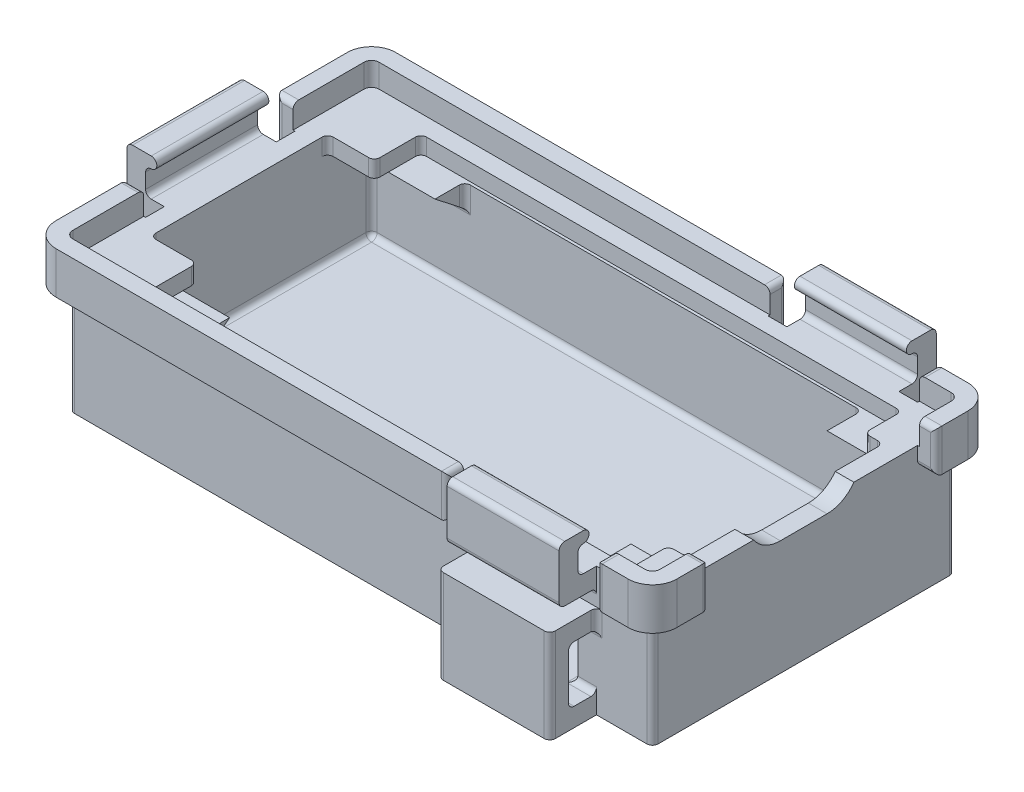
from build123d import *

# Parameters (mm, degrees)
SKETCH_1_W          = 62.5
SKETCH_1_H          = 32.4
SKETCH_1_W_2        = 5
SKETCH_1_H_2        = 0.3
SKETCH_1_W_3        = 6
EXTRUDE_1_DEPTH     = 10
EXTRUDE_2_DEPTH     = 5
EXTRUDE_3_DEPTH     = 6
EXTRUDE_8_DEPTH     = 1.8
FILLET_2_R          = 0.6
SKETCH_3_W          = 62.5
SKETCH_3_H          = 32.4
EXTRUDE_9_DEPTH     = 2
SKETCH_8_W          = 2
SKETCH_8_H          = 4
EXTRUDE_11_DEPTH    = 1.8
SKETCH_5_W          = 8
SKETCH_5_H          = 6
CUT_EXTRUDE_1_DEPTH = 5
SKETCH_6_W          = 12
SKETCH_6_H          = 5
EXTRUDE_10_DEPTH    = 10
SKETCH_9_W          = 3
SKETCH_9_H          = 6
CUT_EXTRUDE_2_DEPTH = 10
FILLET_5_R          = 0.6
FILLET_6_R          = 0.6
SKETCH_10_W         = 4
SKETCH_10_H         = 12
SKETCH_10_W_2       = 12
SKETCH_10_H_2       = 4
EXTRUDE_12_DEPTH    = 2
SKETCH_10_3_W       = 2
SKETCH_10_3_H       = 12
SKETCH_10_3_W_2     = 12
SKETCH_10_3_H_2     = 2
EXTRUDE_13_DEPTH    = 4
SKETCH_11_W         = 0.6
SKETCH_11_H         = 1.2
EXTRUDE_14_DEPTH    = 12
SKETCH_17_R         = 0.6
SKETCH_17_W         = 0.6
SKETCH_17_H         = 1.2
EXTRUDE_19_DEPTH    = 12
FILLET_7_R          = 0.6
EXTRUDE_15_DEPTH    = 2.5
EXTRUDE_15_2_DEPTH  = 2.5
EXTRUDE_15_3_DEPTH  = 2.5
EXTRUDE_15_4_DEPTH  = 2.5
EXTRUDE_16_DEPTH    = 2
FILLET_10_R         = 0.6
SKETCH_15_W         = 5
SKETCH_15_H         = 1.5
EXTRUDE_17_DEPTH    = 1.8
FILLET_3_R          = 0.6
CUT_EXTRUDE_3_DEPTH = 2


with BuildPart() as part:
    # 草图1 → 凸台-拉伸1 (new body)
    # profile 1 of 5: a face of its own
    with BuildSketch(Plane(origin=(0, 0, 0), x_dir=(1, 0, 0), z_dir=(0, 1, 0))):
        with Locations((-2.5, 0)):
            Rectangle(SKETCH_1_W, SKETCH_1_H)
        Polygon((-31.75, -14.2), (-31.75, 14.2), (-26.75, 14.2), (-26.75, 14.5), (-21.75, 14.5), (-21.75, 14.2), (20.75, 14.2), (20.75, 14.5), (26.75, 14.5), (26.75, 14.2), (26.75, 10.5), (26.75, -10.5), (26.75, -14.2), (26.75, -14.5), (20.75, -14.5), (20.75, -14.2), (-21.75, -14.2), (-21.75, -14.5), (-26.75, -14.5), (-26.75, -14.2), align=None, mode=Mode.SUBTRACT)
    # profile 2 of 5: a face of its own
    with BuildSketch(Plane(origin=(0, 0, 0), x_dir=(1, 0, 0), z_dir=(0, 1, 0))):
        with Locations((-24.25, 14.35)):
            Rectangle(SKETCH_1_W_2, SKETCH_1_H_2)
    # profile 3 of 5: a face of its own
    with BuildSketch(Plane(origin=(0, 0, 0), x_dir=(1, 0, 0), z_dir=(0, 1, 0))):
        with Locations((23.75, 14.35)):
            Rectangle(SKETCH_1_W_3, SKETCH_1_H_2)
    # profile 4 of 5: a face of its own
    with BuildSketch(Plane(origin=(0, 0, 0), x_dir=(1, 0, 0), z_dir=(0, 1, 0))):
        with Locations((23.75, -14.35)):
            Rectangle(SKETCH_1_W_3, SKETCH_1_H_2)
    # profile 5 of 5: a face of its own
    with BuildSketch(Plane(origin=(0, 0, 0), x_dir=(1, 0, 0), z_dir=(0, 1, 0))):
        with Locations((-24.25, -14.35)):
            Rectangle(SKETCH_1_W_2, SKETCH_1_H_2)
    extrude(amount=-EXTRUDE_1_DEPTH)

    # Sketch 3D_1 → 凸台-拉伸2 (add, symmetric)
    with BuildSketch(Plane(origin=(-26.75, 0, -11), x_dir=(1.7087554759274007e-15, -0.615644041972315, -0.7880243737245636), z_dir=(1, 0, 0))):
        Polygon((0, 0), (2.521677996, 1.970060934), (4.060788101, 0), align=None)
    extrude_2 = extrude(amount=EXTRUDE_2_DEPTH, both=True)

    # Sketch 3D_2 → 凸台-拉伸3 (add)
    with BuildSketch(Plane(origin=(20.75, 0, -10.5), x_dir=(0, -0.5598574112779874, -0.8285889686914197), z_dir=(1, 0, 0))):
        Polygon((0, 0), (3.065779184, 2.071472422), (4.465422712, 0), align=None)
    extrude_3 = extrude(amount=EXTRUDE_3_DEPTH)

    # 镜向1: 凸台-拉伸2, 凸台-拉伸3 across plane
    add(extrude_2.mirror(Plane.XY))
    add(extrude_3.mirror(Plane.XY))

    # 草图2 → 凸台-拉伸8 (add)
    with BuildSketch(Plane(origin=(0, 0, 0), x_dir=(1, 0, 0), z_dir=(0, 1, 0))):
        Polygon((-31.75, -11), (-31.75, 11), (-26.75, 11), (-26.75, 14.5), (-21.75, 14.5), (20.75, 14.5), (26.75, 14.5), (28.75, 14.5), (28.75, 16.2), (-33.75, 16.2), (-33.75, -16.2), (28.75, -16.2), (28.75, -14.5), (26.75, -14.5), (20.75, -14.5), (-21.75, -14.5), (-26.75, -14.5), (-26.75, -11), align=None)
        Polygon((28.75, 14.5), (26.75, 14.5), (26.75, 10.5), (26.75, -10.5), (26.75, -14.5), (28.75, -14.5), align=None)
    extrude(amount=EXTRUDE_8_DEPTH)

    # 圆角2
    fillet_2_edges = [part.edges().sort_by_distance(p)[0] for p in [
        (23.75, -2.5, 14.2),
        (23.75, -2.5, -14.2),
        (-26.75, -2.5, 14.2),
        (-26.75, 0.9, 14.5),
        (-26.75, -2.5, -14.2),
        (-26.75, 0.9, -14.5),
        (26.75, 0.9, 14.5),
        (26.75, 0.9, -14.5),
        (20.75, -1.25, 14.2),
        (-21.75, -1.25, 14.2),
        (20.75, -1.25, -14.2),
        (-21.75, -1.25, -14.2),
    ]]
    fillet(fillet_2_edges, radius=FILLET_2_R)

    # 草图3 → 凸台-拉伸9 (add)
    with BuildSketch(Plane.XZ.offset(10)):
        with Locations((-2.5, 0)):
            Rectangle(SKETCH_3_W, SKETCH_3_H)
    extrude(amount=EXTRUDE_9_DEPTH)

    # 草图8 → 凸台-拉伸11 (add)
    with BuildSketch(Plane(origin=(0, 0, 0), x_dir=(1, 0, 0), z_dir=(0, 1, 0))):
        with Locations((25.75, 12.5)):
            Rectangle(SKETCH_8_W, SKETCH_8_H)
        with Locations((25.75, -12.5)):
            Rectangle(SKETCH_8_W, SKETCH_8_H)
    extrude(amount=EXTRUDE_11_DEPTH)

    # 草图5 → 切除-拉伸1 (cut)
    with BuildSketch(Plane.XY.offset(16.2)):
        with Locations((16.75, -7)):
            Rectangle(SKETCH_5_W, SKETCH_5_H)
    extrude(amount=-CUT_EXTRUDE_1_DEPTH, mode=Mode.SUBTRACT)

    # 草图6 → 凸台-拉伸10 (add)
    with BuildSketch(Plane.XZ.offset(12)):
        with Locations((16.75, 18.7)):
            Rectangle(SKETCH_6_W, SKETCH_6_H)
    extrude(amount=-EXTRUDE_10_DEPTH)

    # 草图9 → 切除-拉伸2 (cut)
    with BuildSketch(Plane(origin=(22.75, 0, 0), x_dir=(0, 0, -1), z_dir=(1, 0, 0))):
        with Locations((-17.7, -7)):
            Rectangle(SKETCH_9_W, SKETCH_9_H)
    extrude(amount=-CUT_EXTRUDE_2_DEPTH, mode=Mode.SUBTRACT)

    # 圆角5
    fillet_5_edges = [part.edges().sort_by_distance(p)[0] for p in [
        (28.75, -5.1, 16.2),
        (-33.75, -5.1, 16.2),
        (-33.75, -5.1, -16.2),
        (28.75, -5.1, -16.2),
        (22.75, -3, 16.2),
        (22.75, -7, 21.2),
        (10.75, -7, 21.2),
        (10.75, -7, 16.2),
    ]]
    fillet(fillet_5_edges, radius=FILLET_5_R)

    # 圆角6
    fillet_6_edges = [part.edges().sort_by_distance(p)[0] for p in [
        (20.75, -10, 15.2),
        (17.75, -4, 19.2),
        (17.75, -10, 19.2),
        (12.75, -7, 19.2),
        (12.75, -10, 16.7),
        (21.75, -10, 16.2),
        (20.75, -4, 15.2),
        (22.05, -4, 16.2),
        (12.75, -4, 16.7),
    ]]
    fillet(fillet_6_edges, radius=FILLET_6_R)

    # 草图10 → 凸台-拉伸12 (add)
    with BuildSketch(Plane(origin=(0, 1.8, 0), x_dir=(1, 0, 0), z_dir=(0, 1, 0))):
        with Locations((-35.75, 0)):
            Rectangle(SKETCH_10_W, SKETCH_10_H)
        with Locations((16.75, 18.2)):
            Rectangle(SKETCH_10_W_2, SKETCH_10_H_2)
        with Locations((16.75, -18.2)):
            Rectangle(SKETCH_10_W_2, SKETCH_10_H_2)
    extrude(amount=-EXTRUDE_12_DEPTH)

    # 草图10<3> → 凸台-拉伸13 (add)
    with BuildSketch(Plane(origin=(0, 1.8, 0), x_dir=(1, 0, 0), z_dir=(0, 1, 0))):
        with Locations((-36.75, 0)):
            Rectangle(SKETCH_10_3_W, SKETCH_10_3_H)
        with Locations((16.75, 19.2)):
            Rectangle(SKETCH_10_3_W_2, SKETCH_10_3_H_2)
        with Locations((16.75, -19.2)):
            Rectangle(SKETCH_10_3_W_2, SKETCH_10_3_H_2)
    extrude(amount=EXTRUDE_13_DEPTH)

    # 草图11 → 凸台-拉伸14 (add)
    with BuildSketch(Plane.XY.offset(6)):
        with Locations((-35.45, 5.2)):
            Rectangle(SKETCH_11_W, SKETCH_11_H)
        with BuildLine():
            ThreePointArc((-35.15, 5.8), (-34.55, 5.2), (-35.15, 4.6))
            Line((-35.15, 4.6), (-35.15, 5.8))
        make_face()
    extrude(amount=-EXTRUDE_14_DEPTH)

    # 草图17 → 凸台-拉伸19 (add)
    with BuildSketch(Plane(origin=(22.75, 0, 0), x_dir=(0, 0, -1), z_dir=(1, 0, 0))):
        with Locations((-17.6, 5.2)):
            Circle(SKETCH_17_R)
        with Locations((17.6, 5.2)):
            Circle(SKETCH_17_R)
        with Locations((-17.9, 5.2)):
            Rectangle(SKETCH_17_W, SKETCH_17_H)
        with Locations((17.9, 5.2)):
            Rectangle(SKETCH_17_W, SKETCH_17_H)
    extrude(amount=-EXTRUDE_19_DEPTH)

    # 圆角7
    fillet_7_edges = [part.edges().sort_by_distance(p)[0] for p in [
        (-35.75, 4.6, 0),
        (-37.75, 5.8, 0),
        (-37.75, -0.2, 0),
        (-33.75, -0.2, 0),
        (-35.75, 1.8, 0),
        (16.75, 4.6, -18.2),
        (16.75, 1.8, -18.2),
        (16.75, 5.8, -20.2),
        (16.75, -0.2, -20.2),
        (16.75, -0.2, -16.2),
        (16.75, 4.6, 18.2),
        (16.75, 1.8, 18.2),
        (16.75, 5.8, 20.2),
        (16.75, -0.2, 20.2),
        (16.75, -0.2, 16.2),
    ]]
    fillet(fillet_7_edges, radius=FILLET_7_R - 0.0001)  # a hair under: the kernel refuses the full size



with BuildPart() as body_2:
    # 草图12 → 凸台-拉伸15 (new body)
    with BuildSketch(Plane(origin=(0, 1.8, 0), x_dir=(1, 0, 0), z_dir=(0, 1, 0))):
        with BuildLine():
            Line((24.75, 18.2), (24.75, 16.4))
            Line((24.75, 16.4), (28.15, 16.4))
            ThreePointArc((28.15, 16.4), (28.715685425, 16.165685425), (28.95, 15.6))
            Line((28.95, 15.6), (28.95, 12.2))
            Line((28.95, 12.2), (30.75, 12.2))
            Line((30.75, 12.2), (30.75, 15.6))
            ThreePointArc((30.75, 15.6), (29.988477631, 17.438477631), (28.15, 18.2))
            Line((28.15, 18.2), (24.75, 18.2))
        make_face()
    extrude(amount=EXTRUDE_15_DEPTH)


with BuildPart() as body_3:
    # 草图12 → Extrude 15 2 (new body)
    with BuildSketch(Plane(origin=(0, 1.8, 0), x_dir=(1, 0, 0), z_dir=(0, 1, 0))):
        with BuildLine():
            Line((30.75, -12.2), (28.95, -12.2))
            Line((28.95, -12.2), (28.95, -15.6))
            ThreePointArc((28.95, -15.6), (28.715685425, -16.165685425), (28.15, -16.4))
            Line((28.15, -16.4), (24.75, -16.4))
            Line((24.75, -16.4), (24.75, -18.2))
            Line((24.75, -18.2), (28.15, -18.2))
            ThreePointArc((28.15, -18.2), (29.988477631, -17.438477631), (30.75, -15.6))
            Line((30.75, -15.6), (30.75, -12.2))
        make_face()
    extrude(amount=EXTRUDE_15_2_DEPTH)


with BuildPart() as body_4:
    # 草图12 → Extrude 15 3 (new body)
    with BuildSketch(Plane(origin=(0, 1.8, 0), x_dir=(1, 0, 0), z_dir=(0, 1, 0))):
        with BuildLine():
            Line((8.75, -18.2), (8.75, -16.4))
            Line((8.75, -16.4), (-33.15, -16.4))
            ThreePointArc((-33.15, -16.4), (-33.715685425, -16.165685425), (-33.95, -15.6))
            Line((-33.95, -15.6), (-33.95, -8))
            Line((-33.95, -8), (-35.75, -8))
            Line((-35.75, -8), (-35.75, -15.6))
            ThreePointArc((-35.75, -15.6), (-34.988477631, -17.438477631), (-33.15, -18.2))
            Line((-33.15, -18.2), (8.75, -18.2))
        make_face()
    extrude(amount=EXTRUDE_15_3_DEPTH)


with BuildPart() as body_5:
    # 草图12 → Extrude 15 4 (new body)
    with BuildSketch(Plane(origin=(0, 1.8, 0), x_dir=(1, 0, 0), z_dir=(0, 1, 0))):
        with BuildLine():
            Line((-35.75, 8), (-33.95, 8))
            Line((-33.95, 8), (-33.95, 15.6))
            ThreePointArc((-33.95, 15.6), (-33.715685425, 16.165685425), (-33.15, 16.4))
            Line((-33.15, 16.4), (8.75, 16.4))
            Line((8.75, 16.4), (8.75, 18.2))
            Line((8.75, 18.2), (-33.15, 18.2))
            ThreePointArc((-33.15, 18.2), (-34.988477631, 17.438477631), (-35.75, 15.6))
            Line((-35.75, 15.6), (-35.75, 8))
        make_face()
    extrude(amount=EXTRUDE_15_4_DEPTH)


with BuildPart() as part_1:
    add(part.part)

    add(body_2.part)  # 凸台-拉伸16 merges body 2

    add(body_3.part)  # 凸台-拉伸16 merges body 3

    add(body_4.part)  # 凸台-拉伸16 merges body 4

    add(body_5.part)  # 凸台-拉伸16 merges body 5
    # 草图12<3> → 凸台-拉伸16 (add)
    with BuildSketch(Plane(origin=(0, 1.8, 0), x_dir=(1, 0, 0), z_dir=(0, 1, 0))):
        with BuildLine():
            Line((24.75, 16.2), (28.15, 16.2))
            ThreePointArc((28.15, 16.2), (28.574264069, 16.024264069), (28.75, 15.6))
            Line((28.75, 15.6), (28.75, 12.2))
            Line((28.75, 12.2), (30.75, 12.2))
            Line((30.75, 12.2), (30.75, 15.6))
            ThreePointArc((30.75, 15.6), (29.988477631, 17.438477631), (28.15, 18.2))
            Line((28.15, 18.2), (24.75, 18.2))
            Line((24.75, 18.2), (24.75, 16.2))
        make_face()
        with BuildLine():
            Line((28.75, -12.2), (28.75, -15.6))
            ThreePointArc((28.75, -15.6), (28.574264069, -16.024264069), (28.15, -16.2))
            Line((28.15, -16.2), (24.75, -16.2))
            Line((24.75, -16.2), (24.75, -18.2))
            Line((24.75, -18.2), (28.15, -18.2))
            ThreePointArc((28.15, -18.2), (29.988477631, -17.438477631), (30.75, -15.6))
            Line((30.75, -15.6), (30.75, -12.2))
            Line((30.75, -12.2), (28.75, -12.2))
        make_face()
        with BuildLine():
            Line((8.75, -16.2), (-33.15, -16.2))
            ThreePointArc((-33.15, -16.2), (-33.574264069, -16.024264069), (-33.75, -15.6))
            Line((-33.75, -15.6), (-33.75, -8))
            Line((-33.75, -8), (-35.75, -8))
            Line((-35.75, -8), (-35.75, -15.6))
            ThreePointArc((-35.75, -15.6), (-34.988477631, -17.438477631), (-33.15, -18.2))
            Line((-33.15, -18.2), (8.75, -18.2))
            Line((8.75, -18.2), (8.75, -16.2))
        make_face()
        with BuildLine():
            Line((-33.75, 8), (-33.75, 15.6))
            ThreePointArc((-33.75, 15.6), (-33.574264069, 16.024264069), (-33.15, 16.2))
            Line((-33.15, 16.2), (8.75, 16.2))
            Line((8.75, 16.2), (8.75, 18.2))
            Line((8.75, 18.2), (-33.15, 18.2))
            ThreePointArc((-33.15, 18.2), (-34.988477631, 17.438477631), (-35.75, 15.6))
            Line((-35.75, 15.6), (-35.75, 8))
            Line((-35.75, 8), (-33.75, 8))
        make_face()
    extrude(amount=-EXTRUDE_16_DEPTH)

    # 圆角10
    fillet_10_edges = [part_1.edges().sort_by_distance(p)[0] for p in [
        (30.75, 2.05, 12.2),
        (24.75, -0.2, 17.2),
        (24.75, 2.05, 18.2),
        (29.75, -0.2, 12.2),
        (29.85, 4.3, 12.2),
        (24.75, 4.3, 17.3),
        (29.75, -0.2, -12.2),
        (30.75, 2.05, -12.2),
        (24.75, 2.05, -18.2),
        (24.75, -0.2, -17.2),
        (24.75, 4.3, -17.3),
        (29.85, 4.3, -12.2),
        (8.75, -0.2, -17.2),
        (8.75, 2.05, -18.2),
        (-34.75, -0.2, -8),
        (-35.75, 2.05, -8),
        (-34.85, 4.3, -8),
        (8.75, 4.3, -17.3),
        (-35.75, 2.05, 8),
        (8.75, 2.05, 18.2),
        (-34.75, -0.2, 8),
        (8.75, -0.2, 17.2),
        (8.75, 4.3, 17.3),
        (-34.85, 4.3, 8),
    ]]
    fillet(fillet_10_edges, radius=FILLET_10_R)

    # 草图15 → 凸台-拉伸17 (add)
    with BuildSketch(Plane(origin=(0, 1.8, 0), x_dir=(1, 0, 0), z_dir=(0, 1, 0))):
        with Locations((-29.25, 10.25)):
            Rectangle(SKETCH_15_W, SKETCH_15_H)
        with Locations((-29.25, -10.25)):
            Rectangle(SKETCH_15_W, SKETCH_15_H)
    extrude(amount=-EXTRUDE_17_DEPTH)

    # 圆角3
    fillet_3_edges = [part_1.edges().sort_by_distance(p)[0] for p in [
        (-31.75, 0.9, -9.5),
        (-26.75, 0.9, -9.5),
        (-31.75, 0.9, 9.5),
        (-26.75, 0.9, 9.5),
        (-9.2, -10, 14.2),
        (26.75, -1.160781908, 12.217957223),
        (26.75, -1.160781908, -12.217957223),
        (-31.75, -1.159916572, 12.484693213),
        (-31.75, -1.159916572, -12.484693213),
        (26.75, -6.409358598, -14.2),
        (-31.75, -6.396323884, -14.2),
        (-31.75, -6.396323884, 14.2),
        (26.75, -6.409358598, 14.2),
        (-31.75, -10, 0),
        (-2.5, -10, -14.2),
        (26.75, 0.9, -10.5),
        (24.75, 0.9, -14.5),
        (24.75, 0.9, -10.5),
        (26.75, 0.9, 10.5),
        (24.75, 0.9, 10.5),
        (24.75, 0.9, 14.5),
        (26.75, -10, 0),
        (26.75, -2.537246655, -14.129881434),
        (26.75, -2.537246655, 14.129881434),
        (-31.75, -2.529619116, -14.139273518),
        (-31.75, -2.529619116, 14.139273518),
    ]]
    fillet(fillet_3_edges, radius=FILLET_3_R)

    # 草图18 → 切除-拉伸3 (cut)
    with BuildSketch(Plane(origin=(28.75, 0, 0), x_dir=(0, 0, -1), z_dir=(1, 0, 0))):
        with BuildLine():
            Line((-2.5, 7.3), (2.5, 7.3))
            ThreePointArc((2.5, 7.3), (6, 3.8), (2.5, 0.3))
            Line((2.5, 0.3), (-2.5, 0.3))
            ThreePointArc((-2.5, 0.3), (-6, 3.8), (-2.5, 7.3))
        make_face()
    extrude(amount=-CUT_EXTRUDE_3_DEPTH, mode=Mode.SUBTRACT)


solid = part_1.part
